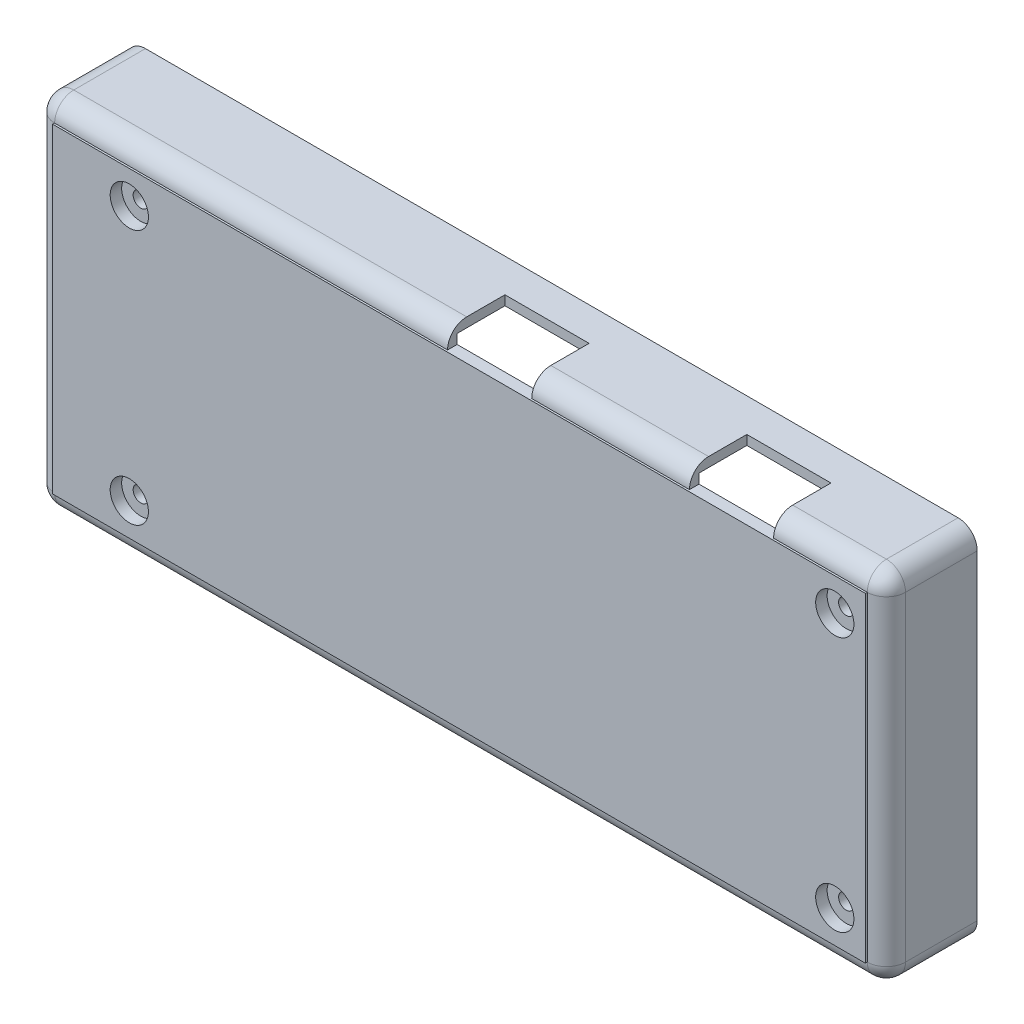
from build123d import *
from OCP.BRepAlgoAPI import BRepAlgoAPI_Cut
from OCP.TopTools import TopTools_ListOfShape

# Parameters (mm, degrees)
EXTRUDE_1_DEPTH      = 9.5
CUT_EXTRUDE_1_DEPTH  = 8.5
SKETCH_4_R           = 2.5
SKETCH_4_W           = 10
SKETCH_4_H           = 2
SKETCH_4_W_2         = 5
EXTRUDE_2_DEPTH      = 5
SKETCH_10_W          = 8.8
SKETCH_10_H          = 6
CUT_EXTRUDE_3_DEPTH  = 2
CUT_EXTRUDE_4_DEPTH  = 3
FILLET_4_R           = 2
FILLET_5_R           = 2
SKETCH_5_R           = 0.8
CUT_EXTRUDE_5_DEPTH  = 10
SKETCH_7_R           = 0.8
CUT_EXTRUDE_6_DEPTH  = 10
SKETCH_6_R           = 0.8
CUT_EXTRUDE_7_DEPTH  = 10
SKETCH_8_R           = 0.8
CUT_EXTRUDE_8_DEPTH  = 10
SKETCH_12_R          = 2
CUT_EXTRUDE_9_DEPTH  = 1
SKETCH_14_W          = 1.5
SKETCH_14_H          = 5
CUT_EXTRUDE_11_DEPTH = 1
SKETCH_15_W          = 1.5
SKETCH_15_H          = 5
CUT_EXTRUDE_12_DEPTH = 1
SKETCH_16_W          = 1.5
SKETCH_16_H          = 5
CUT_EXTRUDE_13_DEPTH = 1
SKETCH_18_W          = 3
SKETCH_18_H          = 3
SKETCH_18_W_2        = 4
SKETCH_18_H_2        = 13.499999703
EXTRUDE_3_DEPTH      = 5
SKETCH_20_W          = 11.8
SKETCH_20_H          = 1.5
CUT_EXTRUDE_16_DEPTH = 1
EXTRUDE_START        = 0.2
SKETCH_21_W          = 85
SKETCH_21_H          = 33.499999703
SKETCH_21_R          = 2
EXTRUDE_4_DEPTH      = 0.2
CUT_EXTRUDE_17_DEPTH = 1
SKETCH_22_W          = 7.8
SKETCH_22_H          = 1
CUT_EXTRUDE_18_DEPTH = 1


with BuildPart() as part:
    # 草图2 → 凸台-拉伸1 (new body)
    with BuildSketch(Plane.XY):
        with BuildLine():
            Line((0, 0), (85, 0))
            ThreePointArc((85, 0), (86.414213562, 0.585786438), (87, 2))
            Line((87, 2), (87, 35.5))
            ThreePointArc((87, 35.5), (86.41421356, 36.914213565), (84.999999993, 37.5))
            Line((84.999999993, 37.5), (-7e-09, 37.499999703))
            ThreePointArc((-7e-09, 37.499999703), (-1.414213565, 36.914213263), (-2, 35.499999703))
            Line((-2, 35.499999703), (-2, 1.999999703))
            ThreePointArc((-2, 1.999999703), (-1.414213353, 0.585786351), (0, 0))
        make_face()
    extrude(amount=EXTRUDE_1_DEPTH)

    # 草图3 → 切除-拉伸1 (cut)
    with BuildSketch(Plane(origin=(0, 0, 0), x_dir=(-1, 0, 0), z_dir=(0, 0, -1))):
        with BuildLine():
            Line((-83, 2), (-2.008987521, 2))
            ThreePointArc((-2.008987521, 2), (-0.594773959, 2.585786438), (-0.008987521, 4))
            Line((-0.008987521, 4), (-0.008987521, 33.499999703))
            ThreePointArc((-0.008987521, 33.499999703), (-0.594773959, 34.914213266), (-2.008987521, 35.499999703))
            Line((-2.008987521, 35.499999703), (-83, 35.499999703))
            ThreePointArc((-83, 35.499999703), (-84.414213562, 34.914213266), (-85, 33.499999703))
            Line((-85, 33.499999703), (-85, 4))
            ThreePointArc((-85, 4), (-84.414213562, 2.585786438), (-83, 2))
        make_face()
    extrude(amount=-CUT_EXTRUDE_1_DEPTH, mode=Mode.SUBTRACT)

    # 草图4 → 凸台-拉伸2 (add)
    with BuildSketch(Plane(origin=(0, 0, 8.5), x_dir=(-1, 0, 0), z_dir=(0, 0, -1))):
        with Locations((-81.8, 32.099999703)):
            Circle(SKETCH_4_R)
        with Locations((-8.008987521, 32.099999703)):
            Circle(SKETCH_4_R)
        with Locations((-8.008987521, 5.4)):
            Circle(SKETCH_4_R)
        with Locations((-81.8, 5.4)):
            Circle(SKETCH_4_R)
        with Locations((-28.008987521, 34.499999703)):
            Rectangle(SKETCH_4_W, SKETCH_4_H)
        with Locations((-62.5, 3)):
            Rectangle(SKETCH_4_W_2, SKETCH_4_H)
    extrude(amount=EXTRUDE_2_DEPTH)

    # 草图10 → 切除-拉伸3 (cut)
    with BuildSketch(Plane(origin=(-1.31e-07, 37.499999703, 0), x_dir=(1.0, 3.4902577560140295e-09, 0), z_dir=(-3.4902577560140295e-09, 1.0, 0))):
        with Locations((45.500000124, -6.5)):
            Rectangle(SKETCH_10_W, SKETCH_10_H)
        with Locations((70.800000124, -6.5)):
            Rectangle(SKETCH_10_W, SKETCH_10_H)
    extrude(amount=-CUT_EXTRUDE_3_DEPTH, mode=Mode.SUBTRACT)

    # 草图11 → 切除-拉伸4 (cut)
    with BuildSketch(Plane.ZY.offset(2)):
        with BuildLine():
            Line((0, 20.349999703), (0, 17.149999703))
            ThreePointArc((0, 17.149999703), (1.6, 18.749999703), (0, 20.349999703))
        make_face()
    extrude(amount=-CUT_EXTRUDE_4_DEPTH, mode=Mode.SUBTRACT)

    # 圆角4
    fillet_4_edges = [part.edges().sort_by_distance(p)[0] for p in [
        (80.099999993, 37.499999983, 9.5),
        (86.41421356, 36.914213565, 9.5),
        (87, 18.75, 9.5),
        (86.414213562, 0.585786438, 9.5),
        (42.5, 0, 9.5),
        (-1.414213396, 0.585786394, 9.5),
        (-2, 18.749999703, 9.5),
        (-1.414213565, 36.914213263, 9.5),
        (20.549999993, 37.499999775, 9.5),
    ]]
    fillet(fillet_4_edges, radius=FILLET_4_R - 0.0001)  # a hair under: the kernel refuses the full size

    # 圆角5
    fillet_5_edges = [part.edges().sort_by_distance(p)[0] for p in [
        (58.149999993, 37.499999906, 9.5),
    ]]
    fillet(fillet_5_edges, radius=FILLET_5_R)

    # 草图5 → 切除-拉伸5 (cut)
    with BuildSketch(Plane(origin=(0, 0, 3.5), x_dir=(-1, 0, 0), z_dir=(0, 0, -1))):
        with Locations((-81.8, 32.099999703)):
            Circle(SKETCH_5_R)
    extrude(amount=-CUT_EXTRUDE_5_DEPTH, mode=Mode.SUBTRACT)

    # 草图7 → 切除-拉伸6 (cut)
    with BuildSketch(Plane(origin=(0, 0, 3.5), x_dir=(-1, 0, 0), z_dir=(0, 0, -1))):
        with Locations((-8.008987521, 5.4)):
            Circle(SKETCH_7_R)
    extrude(amount=-CUT_EXTRUDE_6_DEPTH, mode=Mode.SUBTRACT)

    # 草图6 → 切除-拉伸7 (cut)
    with BuildSketch(Plane(origin=(0, 0, 3.5), x_dir=(-1, 0, 0), z_dir=(0, 0, -1))):
        with Locations((-8.008987521, 32.099999703)):
            Circle(SKETCH_6_R)
    extrude(amount=-CUT_EXTRUDE_7_DEPTH, mode=Mode.SUBTRACT)

    # 草图8 → 切除-拉伸8 (cut)
    with BuildSketch(Plane(origin=(0, 0, 3.5), x_dir=(-1, 0, 0), z_dir=(0, 0, -1))):
        with Locations((-81.8, 5.4)):
            Circle(SKETCH_8_R)
    extrude(amount=-CUT_EXTRUDE_8_DEPTH, mode=Mode.SUBTRACT)

    # 草图12 → 切除-拉伸9 (cut)
    with BuildSketch(Plane.XY.offset(9.5)):
        with Locations((8.008987521, 32.099999703)):
            Circle(SKETCH_12_R)
        with Locations((81.8, 32.099999703)):
            Circle(SKETCH_12_R)
        with Locations((81.8, 5.4)):
            Circle(SKETCH_12_R)
        with Locations((8.008987521, 5.4)):
            Circle(SKETCH_12_R)
    extrude(amount=-CUT_EXTRUDE_9_DEPTH, mode=Mode.SUBTRACT)

    # 草图14 → 切除-拉伸11 (cut)
    with BuildSketch(Plane.XZ.offset(-35.499999703)):
        with Locations((50.65, 6)):
            Rectangle(SKETCH_14_W, SKETCH_14_H)
        with Locations((65.65, 6)):
            Rectangle(SKETCH_14_W, SKETCH_14_H)
    extrude(amount=-CUT_EXTRUDE_11_DEPTH, mode=Mode.SUBTRACT)

    # 草图15 → 切除-拉伸12 (cut)
    with BuildSketch(Plane.XZ.offset(-35.499999703)):
        with Locations((75.95, 6)):
            Rectangle(SKETCH_15_W, SKETCH_15_H)
    extrude(amount=-CUT_EXTRUDE_12_DEPTH, mode=Mode.SUBTRACT)

    # 草图16 → 切除-拉伸13 (cut)
    with BuildSketch(Plane.XZ.offset(-35.499999703)):
        with Locations((40.35, 6)):
            Rectangle(SKETCH_16_W, SKETCH_16_H)
    extrude(amount=-CUT_EXTRUDE_13_DEPTH, mode=Mode.SUBTRACT)

    # 草图18 → 凸台-拉伸3 (add)
    with BuildSketch(Plane(origin=(0, 0, 8.5), x_dir=(-1, 0, 0), z_dir=(0, 0, -1))):
        with Locations((-78.5, 9.5)):
            Rectangle(SKETCH_18_W, SKETCH_18_H)
        with Locations((-78.5, 27.999999703)):
            Rectangle(SKETCH_18_W, SKETCH_18_H)
        with Locations((-35.008987521, 18.749999852)):
            Rectangle(SKETCH_18_W_2, SKETCH_18_H_2)
    extrude(amount=EXTRUDE_3_DEPTH)

    # 草图20 → 切除-拉伸16 (cut)
    with BuildSketch(Plane.XZ.offset(-35.499999703)):
        with Locations((45.5, 2.75)):
            Rectangle(SKETCH_20_W, SKETCH_20_H)
        with Locations((70.8, 2.75)):
            Rectangle(SKETCH_20_W, SKETCH_20_H)
    extrude(amount=-CUT_EXTRUDE_16_DEPTH, mode=Mode.SUBTRACT)

    # 草图21 → 凸台-拉伸4 (add)
    with BuildSketch(Plane.XY.offset(9.5).offset(EXTRUDE_START)):
        with Locations((42.5, 18.749999852)):
            Rectangle(SKETCH_21_W, SKETCH_21_H)
        with Locations((8.008987521, 32.099999703)):
            Circle(SKETCH_21_R, mode=Mode.SUBTRACT)
        with Locations((8.008987521, 5.4)):
            Circle(SKETCH_21_R, mode=Mode.SUBTRACT)
        with Locations((81.8, 32.099999703)):
            Circle(SKETCH_21_R, mode=Mode.SUBTRACT)
        with Locations((81.8, 5.4)):
            Circle(SKETCH_21_R, mode=Mode.SUBTRACT)
    extrude(amount=-EXTRUDE_4_DEPTH)


with BuildPart() as cut_extrude_17_tool:
    # 草图19 → 切除-拉伸17 (new body)
    with BuildSketch(Plane(origin=(0, 0, 0), x_dir=(-1, 0, 0), z_dir=(0, 0, -1))):
        with BuildLine():
            Line((-84, 36.499999703), (-1.008987521, 36.499999703))
            ThreePointArc((-1.008987521, 36.499999703), (0.369417354, 35.949137378), (0.988510914, 34.599999703))
            Line((0.988510914, 34.599999703), (0.995506239, 20.349999703))
            Line((0.995506239, 20.349999703), (-0.008987521, 20.349999703))
            Line((-0.008987521, 20.349999703), (-0.008987521, 33.599999703))
            ThreePointArc((-0.008987521, 33.599999703), (-0.628081081, 34.949137378), (-2.006485957, 35.499999703))
            Line((-2.006485957, 35.499999703), (-83, 35.499999703))
            ThreePointArc((-83, 35.499999703), (-84.414213562, 34.914213266), (-85, 33.499999703))
            Line((-85, 33.499999703), (-85, 4))
            ThreePointArc((-85, 4), (-84.414213562, 2.585786438), (-83, 2))
            Line((-83, 2), (-2.006485957, 2))
            ThreePointArc((-2.006485957, 2), (-0.628081081, 2.550862325), (-0.008987521, 3.9))
            Line((-0.008987521, 3.9), (-0.008987521, 17.149999703))
            Line((-0.008987521, 17.149999703), (0.995506239, 17.149999703))
            Line((0.995506239, 17.149999703), (0.988510914, 2.9))
            ThreePointArc((0.988510914, 2.9), (0.369417354, 1.550862325), (-1.008987521, 1))
            Line((-1.008987521, 1), (-84, 1))
            ThreePointArc((-84, 1), (-85.414213562, 1.585786438), (-86, 3))
            Line((-86, 3), (-86, 34.499999703))
            ThreePointArc((-86, 34.499999703), (-85.414213562, 35.914213266), (-84, 36.499999703))
        make_face()
    extrude(amount=-CUT_EXTRUDE_17_DEPTH)


with BuildPart() as part_1:
    add(part.part)

    # 切除-拉伸17: cut by cut_extrude_17_tool, with a tolerance
    cut_extrude_17_stock = TopTools_ListOfShape()
    cut_extrude_17_stock.Append(part_1.part.wrapped)
    cut_extrude_17_tools = TopTools_ListOfShape()
    cut_extrude_17_tools.Append(cut_extrude_17_tool.part.wrapped)
    cut_extrude_17_cut = BRepAlgoAPI_Cut()
    cut_extrude_17_cut.SetArguments(cut_extrude_17_stock)
    cut_extrude_17_cut.SetTools(cut_extrude_17_tools)
    cut_extrude_17_cut.SetFuzzyValue(0.00001)
    cut_extrude_17_cut.Build()
    add(Compound.cast(cut_extrude_17_cut.Shape()).solids(), mode=Mode.REPLACE)

    # 草图22 → 切除-拉伸18 (cut)
    with BuildSketch(Plane(origin=(0, 0, 1), x_dir=(-1, 0, 0), z_dir=(0, 0, -1))):
        with Locations((-21.6, 1.5)):
            Rectangle(SKETCH_22_W, SKETCH_22_H)
    extrude(amount=-CUT_EXTRUDE_18_DEPTH, mode=Mode.SUBTRACT)


solid = part_1.part
